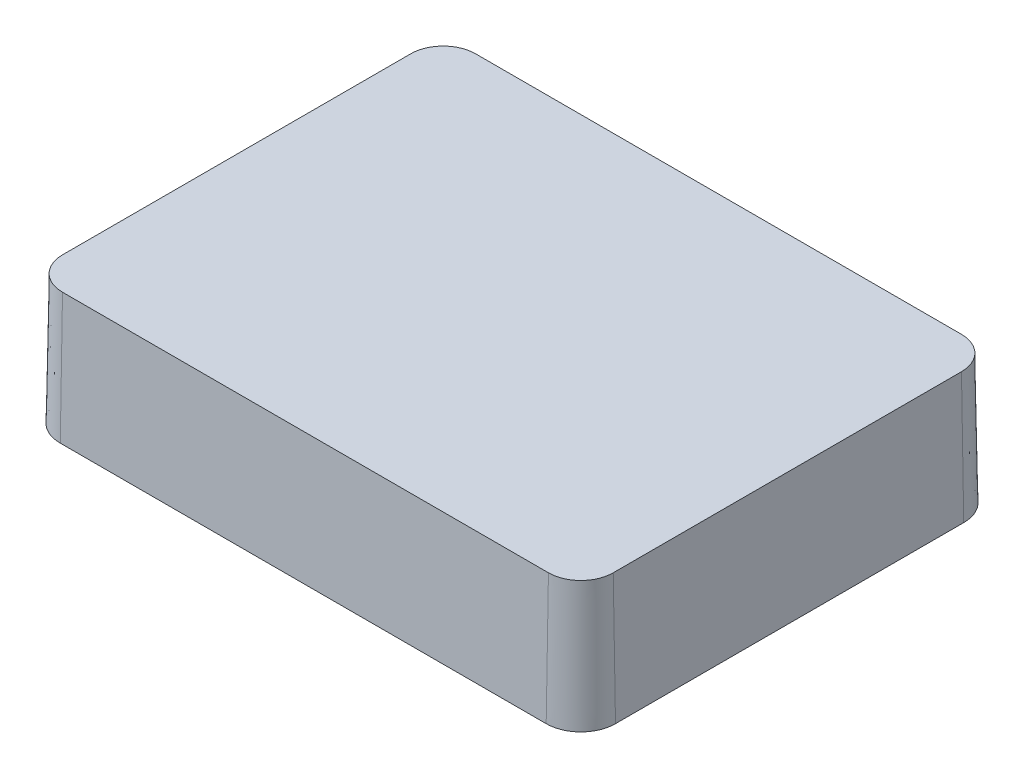
from build123d import *

# Parameters (mm, degrees)
BOSS_EXTRUDE1_DEPTH = 4
BOSS_EXTRUDE1_DRAFT = 1
SHELL1_T            = -0.5
SKETCH2_R           = 2
BOSS_EXTRUDE2_DEPTH = 5.5
BOSS_EXTRUDE2_TAPER = 1.5
CIRPATTERN1_COUNT   = 4
SKETCH4_R           = 1.605977431
CUT_EXTRUDE1_DEPTH  = 5.5
CUT_EXTRUDE1_DRAFT  = 1.5


with BuildPart() as part:
    # Sketch1 → Boss-Extrude1 (with draft: the straight prism first)
    with BuildSketch(Plane(origin=(0, 0, 0), x_dir=(1, 0, 0), z_dir=(0, 1, 0))):
        with BuildLine():
            Line((-7.5, -6.375), (7.5, -6.375))
            ThreePointArc((7.5, -6.375), (8.207106781, -6.082106781), (8.5, -5.375))
            Line((8.5, -5.375), (8.5, 5.375))
            ThreePointArc((8.5, 5.375), (8.207106781, 6.082106781), (7.5, 6.375))
            Line((7.5, 6.375), (-7.5, 6.375))
            ThreePointArc((-7.5, 6.375), (-8.207106781, 6.082106781), (-8.5, 5.375))
            Line((-8.5, 5.375), (-8.5, -5.375))
            ThreePointArc((-8.5, -5.375), (-8.207106781, -6.082106781), (-7.5, -6.375))
        make_face()
    extrude(amount=-BOSS_EXTRUDE1_DEPTH)
    # Boss-Extrude1: the draft: its side faces are tilted about the plane it starts from
    boss_extrude1_sides = [part.faces().sort_by_distance(p)[0] for p in [
        (0, -2, 6.375),
        (8.207106781, -2, 6.082106781),
        (8.5, -2, 0),
        (8.207106781, -2, -6.082106781),
        (0, -2, -6.375),
        (-8.207106781, -2, -6.082106781),
        (-8.5, -2, 0),
        (-8.207106781, -2, 6.082106781),
    ]]
    draft(boss_extrude1_sides, Plane(origin=(0, 0, 0), x_dir=(1, 0, 0), z_dir=(0, 1, 0)), BOSS_EXTRUDE1_DRAFT)

    # Shell1
    shell1_openings = [part.faces().sort_by_distance(p)[0] for p in [
        (0, -4, 0),
    ]]
    offset(amount=SHELL1_T, openings=shell1_openings, kind=Kind.INTERSECTION)

    # Sketch2 → Boss-Extrude2 (add)
    with BuildSketch(Plane.XZ.offset(0.5)):
        Circle(SKETCH2_R)
    extrude(amount=BOSS_EXTRUDE2_DEPTH, taper=BOSS_EXTRUDE2_TAPER)

    # Rib1: read off the stored shape, not the designer's step
    # Rib1: loft between two sections, ruled curve by curve
    rib1_from = [
        Edge.make_line((1.98200897, -0.5, 0.267657325), (3, -0.5, 0.25)),
        Edge.make_line((1.98200897, -0.5, -0.267657325), (3, -0.5, -0.25)),
        Edge.make_line((3, -0.5, -0.25), (3, -0.5, 0.25)),
        Edge.make_line((1.98200897, -0.5, -0.267657325), (1.98200897, -0.5, 0.267657325)),
    ]
    rib1_to = [
        Edge.make_line((1.837759395, -6, 0.259408234), (2.380168761, -6, 0.25)),
        Edge.make_line((1.837759395, -6, -0.259408234), (2.380168761, -6, -0.25)),
        Edge.make_line((2.380168761, -6, -0.25), (2.380168761, -6, 0.25)),
        Edge.make_line((1.837759395, -6, -0.259408234), (1.837759395, -6, 0.259408234)),
    ]
    rib1 = Solid(Shell([*[Face.make_surface_from_curves(rib1_from[k], rib1_to[k]) for k in range(4)], Face(Wire(rib1_from)), Face(Wire(rib1_to))]))
    add(rib1)

    # CirPattern1: Rib1 ×4 about axis
    cirpattern1_axis = Axis((0, 0, 0), (0, 1, 0))
    for i in range(1, CIRPATTERN1_COUNT):
        add(rib1.rotate(cirpattern1_axis, i * 360 / CIRPATTERN1_COUNT))


with BuildPart() as cut_extrude1_tool:
    # Sketch4 → Cut-Extrude1 (with draft: the straight prism first)
    with BuildSketch(Plane.XZ.offset(6)):
        Circle(SKETCH4_R)
    extrude(amount=-CUT_EXTRUDE1_DEPTH)
    # Cut-Extrude1: the draft: its side faces are tilted about the plane it starts from
    cut_extrude1_sides = [cut_extrude1_tool.faces().sort_by_distance(p)[0] for p in [
        (-1.605977431, -3.25, 0),
    ]]
    draft(cut_extrude1_sides, Plane.XZ.offset(6), CUT_EXTRUDE1_DRAFT)


with BuildPart() as part_1:
    add(part.part)

    # Cut-Extrude1: cut by cut_extrude1_tool
    add(cut_extrude1_tool.part, mode=Mode.SUBTRACT)


solid = part_1.part
